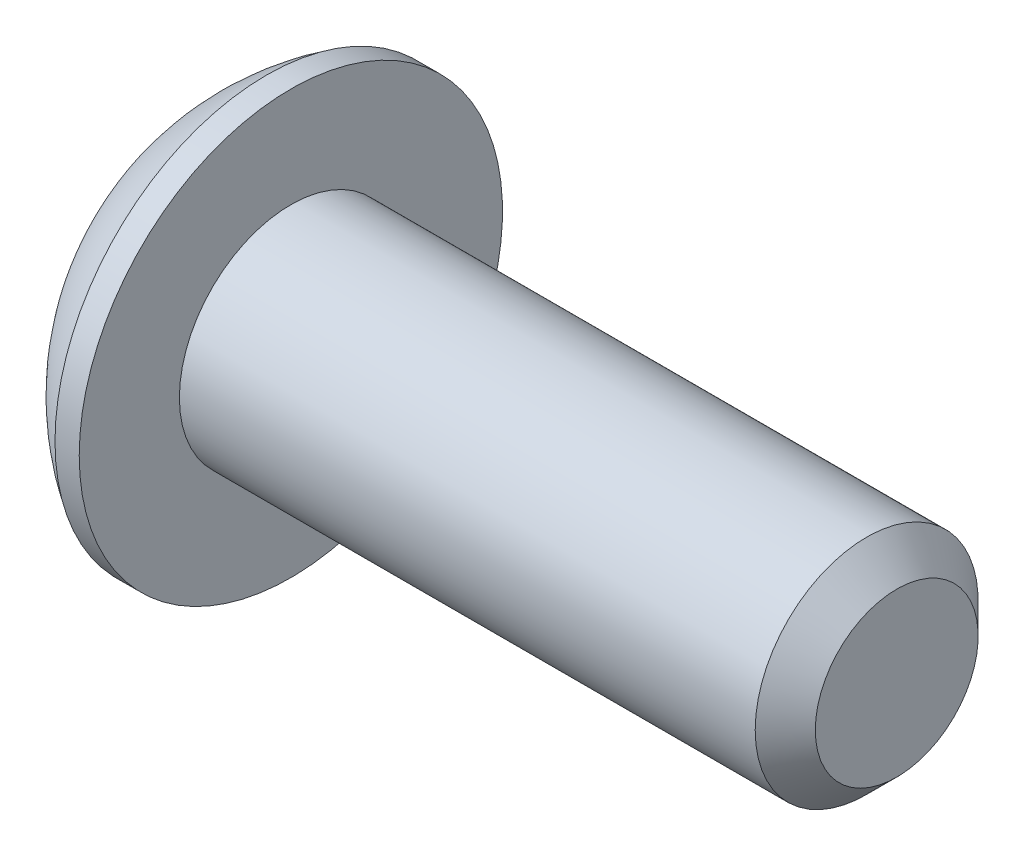
from build123d import *

# Parameters (mm, degrees)
HEX_2_DEPTH = 1.1176


with BuildPart() as part:
    # BodySke → BaseBody (revolve)
    with BuildSketch(Plane.XY):
        with BuildLine():
            Line((11.3792, 0), (11.3792, 1.28016))
            Line((11.3792, 1.28016), (10.90676, 1.7526))
            Line((10.90676, 1.7526), (1.8542, 1.7526))
            Line((1.8542, 1.7526), (1.8542, 3.3274))
            Line((1.8542, 3.3274), (1.4732, 3.3274))
            ThreePointArc((1.4732, 3.3274), (0.616396771, 2.601989501), (0, 1.6637))
            Line((0, 1.6637), (0, 0))
            Line((0, 0), (11.3792, 0))
        make_face()
    revolve(axis=Axis((0, 0, 0), (1, 0, 0)))

    # Sketch2 → PreBroach (revolve, cut)
    with BuildSketch(Plane.XY):
        Polygon((0, 0.9906), (1.1176, 0.9906), (1.689523177, 0), (0, 0), align=None)
    revolve(axis=Axis((0, 0, 0), (1, 0, 0)), mode=Mode.SUBTRACT)

    # Sketch3 → Hex 2 (cut)
    with BuildSketch(Plane(origin=(0, 0, 0), x_dir=(0, 0, -1), z_dir=(1, 0, 0))):
        Polygon((-0.9906, -0.571923177), (-0.9906, 0.571923177), (0, 1.143846353), (0.9906, 0.571923177), (0.9906, -0.571923177), (0, -1.143846353), align=None)
    extrude(amount=HEX_2_DEPTH, mode=Mode.SUBTRACT)


solid = part.part
